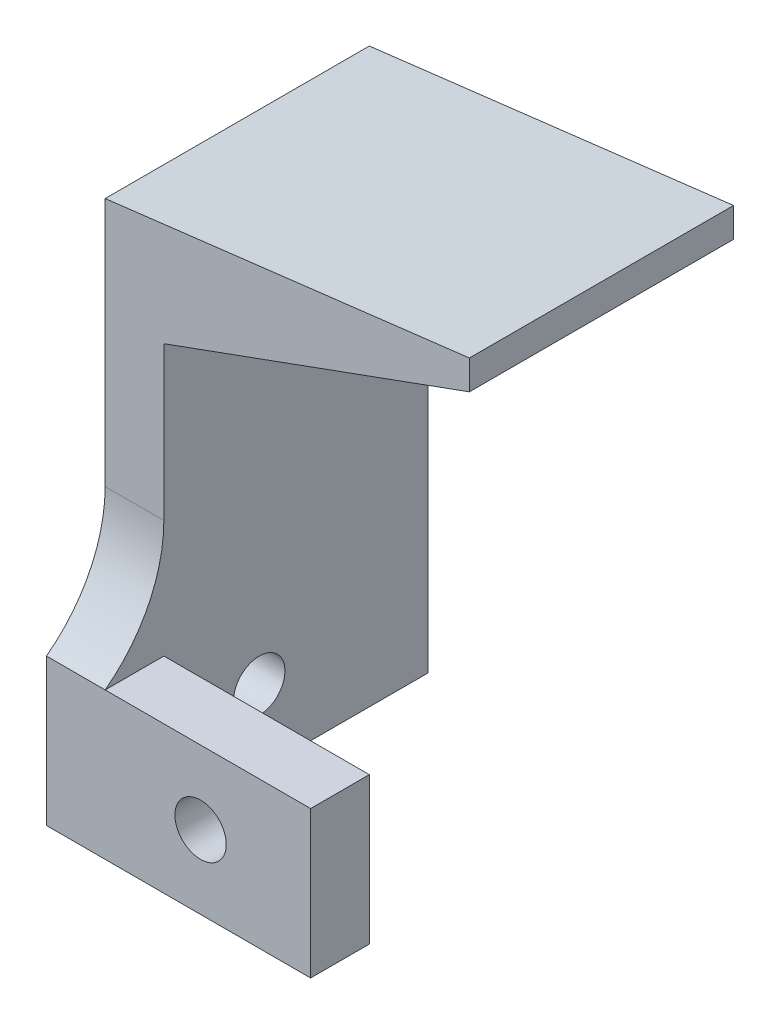
from build123d import *

# Parameters (mm, degrees)
EXTRUDE_1_DEPTH     = 18
SKETCH_2_R          = 1.75
CUT_EXTRUDE_1_DEPTH = 13
SKETCH_3_W          = 18
SKETCH_3_H          = 10
EXTRUDE_2_DEPTH     = 4
SKETCH_10_R         = 1.75
CUT_EXTRUDE_2_DEPTH = 49.825569575
FILLET_1_R          = 10


with BuildPart() as part:
    # 草图1 → 凸台-拉伸1 (new body)
    with BuildSketch(Plane.XY):
        Polygon((0, 0), (4, 0), (4, 28.432425182), (24.819457366, 35.999089204), (24.819457366, 37.999089204), (0, 35), align=None)
    extrude(amount=EXTRUDE_1_DEPTH)

    # 草图2 → 切除-拉伸1 (cut)
    with BuildSketch(Plane.ZY):
        with Locations(Location((11.5, 5, 0), (0, 0, 270))):
            Circle(SKETCH_2_R)
    extrude(amount=-CUT_EXTRUDE_1_DEPTH, mode=Mode.SUBTRACT)

    # 草图3 → 凸台-拉伸2 (add)
    with BuildSketch(Plane.XY.offset(18)):
        with Locations((9, 5)):
            Rectangle(SKETCH_3_W, SKETCH_3_H)
    extrude(amount=EXTRUDE_2_DEPTH)

    # 草图10 → 切除-拉伸2 (cut, through all)
    with BuildSketch(Plane(origin=(0, 0, 18), x_dir=(-1, 0, 0), z_dir=(0, 0, -1))):
        with Locations((-10.5, 5)):
            Circle(SKETCH_10_R)
    extrude(amount=-CUT_EXTRUDE_2_DEPTH, mode=Mode.SUBTRACT)

    # 圆角1
    # the kernel refuses this fillet: 10 mm, written as the material it adds along each edge
    with BuildSketch(Plane(origin=(4, 10, 18), x_dir=(0, 1, 0), z_dir=(-1, 0, 0))) as fillet_1_piece_1:
        with BuildLine():
            CenterArc((8, -10), FILLET_1_R, 90, 53.130102354)
            Line((0, -4), (0, 0))
            Line((0, 0), (8, 0))
        make_face()
    extrude(amount=4)


solid = part.part
